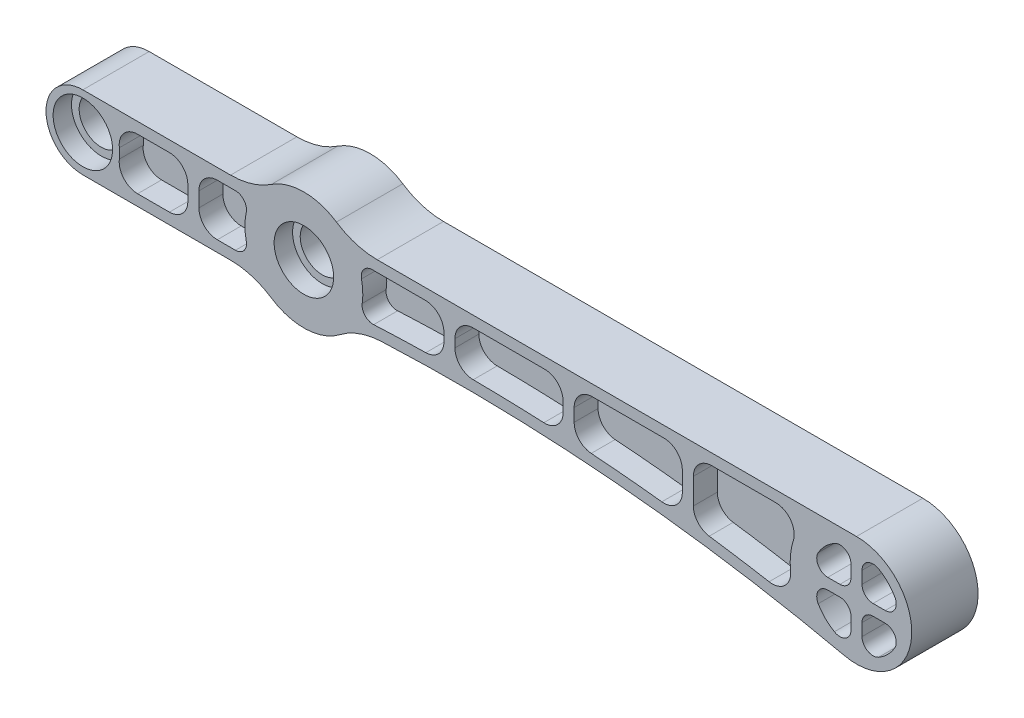
from build123d import *
from build123d.topology import SkipClean

# Parameters (mm, degrees)
SKETCH1_R               = 15
SKETCH1_R_2             = 12
EXTRUDE_THIN1_DEPTH     = 9
SKETCH2_W               = 3
SKETCH2_H               = 27
SKETCH2_W_2             = 27
SKETCH2_H_2             = 3
EXTRUDE_THIN2_DEPTH     = 18
FILLET1_R               = 3
EXTRUDE_THIN3_START     = -18
EXTRUDE_THIN3_DEPTH     = 18
EXTRUDE_THIN4_START     = -18
SKETCH4_R               = 10
SKETCH4_R_2             = 7
EXTRUDE_THIN4_DEPTH     = 18
EXTRUDE_THIN5_START     = -18
SKETCH5_R               = 10
SKETCH5_R_2             = 7
EXTRUDE_THIN5_DEPTH     = 18
BOSS_EXTRUDE1_DEPTH     = 2.5
SKETCH7_W               = 3
SKETCH7_H               = 14
SKETCH7_H_2             = 15
SKETCH7_H_3             = 12.5
SKETCH7_H_4             = 18
EXTRUDE_THIN6_DEPTH     = 6.5
FILLET2_R               = 5
FILLET3_R               = 5
BOSS_EXTRUDE4_START     = -18
SKETCH12_R              = 16
SKETCH12_R_2            = 7
BOSS_EXTRUDE4_DEPTH     = 18
CUT_EXTRUDE1_DEPTH      = 222.731820116
CUT_EXTRUDE1_DEPTH_BACK = 222.731820116
SKETCH8_R               = 11.075
BOSS_EXTRUDE2_START     = -5
SKETCH9_R               = 11.075
SKETCH9_R_2             = 6
BOSS_EXTRUDE2_DEPTH     = 8
CUT_EXTRUDE2_DEPTH      = 222.731820116
CUT_EXTRUDE2_DEPTH_BACK = 222.731820116
SKETCH10_R              = 8.075
BOSS_EXTRUDE3_START     = -5
SKETCH11_R              = 8.075
SKETCH11_R_2            = 6
BOSS_EXTRUDE3_DEPTH     = 8
FILLET4_R               = 3
FILLET5_R               = 20
BOSS_EXTRUDE5_START     = -18
SKETCH13_R              = 11.15
SKETCH13_R_2            = 8.075
BOSS_EXTRUDE5_DEPTH     = 18


# Read off the part's stored shape, not the designer's step: Extrude-Thin3
with BuildPart() as part:
    # Sketch1 → Extrude-Thin1 (new, symmetric)
    with BuildSketch(Plane.XY):
        Circle(SKETCH1_R)
        Circle(SKETCH1_R_2, mode=Mode.SUBTRACT)
    extrude(amount=EXTRUDE_THIN1_DEPTH, both=True)

    # Sketch2 → Extrude-Thin2 (add)
    with BuildSketch(Plane.XY.offset(9)):
        Rectangle(SKETCH2_W, SKETCH2_H)
        Rectangle(SKETCH2_W_2, SKETCH2_H_2)
    extrude(amount=-EXTRUDE_THIN2_DEPTH)

    # Fillet1
    fillet1_edges = [part.edges().sort_by_distance(p)[0] for p in [
        (-11.9058809, 1.5, 0),
        (-11.9058809, -1.5, 0),
        (11.9058809, -1.5, 0),
        (11.9058809, 1.5, 0),
        (1.5, -11.9058809, 0),
        (-1.5, -11.9058809, 0),
        (1.5, 11.9058809, 0),
        (-1.5, 11.9058809, 0),
        (-1.5, 1.5, 0),
        (1.5, -1.5, 0),
        (1.5, 1.5, 0),
        (-1.5, -1.5, 0),
    ]]
    fillet(fillet1_edges, radius=FILLET1_R)

    # Extrude-Thin3 outline → Extrude-Thin3 (add)
    with BuildSketch(Plane.XY.offset(9).offset(EXTRUDE_THIN3_START)):
        with BuildLine():
            Line((-210, -5), (-150, -5))
            ThreePointArc((-150, -5), (-149.566221763, -4.990587392), (-149.133260122, -4.962367288))
            ThreePointArc((-149.133260122, -4.962367288), (-75.827129103, -4.209836845), (-3.263016957, -14.640789608))
            ThreePointArc((-3.263016957, -14.640789608), (-14.909926964, 1.641364658), (0, 15))
            Line((0, 15), (-210, 15))
            ThreePointArc((-210, 15), (-220, 5), (-210, -5))
        make_face()
        with BuildLine():
            ThreePointArc((-149.393282085, -1.973657102), (-149.696355234, -1.993411175), (-150, -2))
            Line((-150, -2), (-210, -2))
            ThreePointArc((-210, -2), (-217, 5), (-210, 12))
            Line((-210, 12), (-13.416407865, 12))
            ThreePointArc((-13.416407865, 12), (-17.904937547, 1.84748787), (-15.584042572, -9.007642151))
            ThreePointArc((-15.584042572, -9.007642151), (-82.243303745, -0.823132527), (-149.393282085, -1.973657102))
        make_face(mode=Mode.SUBTRACT)
    extrude(amount=EXTRUDE_THIN3_DEPTH)

    # Sketch4 → Extrude-Thin4 (add)
    with SkipClean():  # the faces are left unmerged after this step: merging them gives an invalid solid
        with BuildSketch(Plane.XY.offset(9).offset(EXTRUDE_THIN4_START)):
            with Locations((-210, 5)):
                Circle(SKETCH4_R)
            with Locations((-210, 5)):
                Circle(SKETCH4_R_2, mode=Mode.SUBTRACT)
        extrude(amount=EXTRUDE_THIN4_DEPTH)

    # Sketch5 → Extrude-Thin5 (add)
    with SkipClean():  # the faces are left unmerged after this step: merging them gives an invalid solid
        with BuildSketch(Plane.XY.offset(9).offset(EXTRUDE_THIN5_START)):
            with Locations((-150, 5)):
                Circle(SKETCH5_R)
            with Locations((-150, 5)):
                Circle(SKETCH5_R_2, mode=Mode.SUBTRACT)
        extrude(amount=EXTRUDE_THIN5_DEPTH)

    # Sketch6 → Boss-Extrude1 (add, symmetric)
    with SkipClean():  # the faces are left unmerged after this step: merging them gives an invalid solid
        with BuildSketch(Plane.XY):
            with BuildLine():
                Line((-157.141428429, -2), (-202.858571571, -2))
                ThreePointArc((-202.858571571, -2), (-200, 5), (-202.858571571, 12))
                Line((-202.858571571, 12), (-157.141428429, 12))
                ThreePointArc((-157.141428429, 12), (-160, 5), (-157.141428429, -2))
            make_face()
            with BuildLine():
                Line((-13.416407865, 12), (-142.858571571, 12))
                ThreePointArc((-142.858571571, 12), (-140.007891732, 5.397205692), (-142.325456853, -1.411036381))
                ThreePointArc((-142.325456853, -1.411036381), (-78.703783865, -1.022236838), (-15.584042572, -9.007642151))
                ThreePointArc((-15.584042572, -9.007642151), (-17.904937547, 1.84748787), (-13.416407865, 12))
            make_face()
        extrude(amount=BOSS_EXTRUDE1_DEPTH, both=True)

    # Sketch7 → Extrude-Thin6 (add)
    with SkipClean():  # the faces are left unmerged after this step: merging them gives an invalid solid
        with BuildSketch(Plane.XY.offset(9)):
            with Locations((-180, 5)):
                Rectangle(SKETCH7_W, SKETCH7_H)
            with Locations((-78.137489718, 4.5)):
                Rectangle(SKETCH7_W, SKETCH7_H_2)
            with Locations((-110.498030645, 5.75)):
                Rectangle(SKETCH7_W, SKETCH7_H_3)
            with Locations((-45.776948792, 3)):
                Rectangle(SKETCH7_W, SKETCH7_H_4)
        extrude_thin6 = extrude(amount=-EXTRUDE_THIN6_DEPTH)

    # Fillet2
    fillet2_edges = [part.edges().sort_by_distance(p)[0] for p in [
        (-202.858571571, 12, 5.75),
        (-202.858571571, -2, 5.75),
        (-142.858571571, 12, 5.75),
        (-157.141428429, -2, 5.75),
        (-157.141428429, 12, 5.75),
        (-142.325456853, -1.411036382, 5.75),
        (-15.584042572, -9.007642151, 5.75),
        (-13.416407865, 12, 5.75),
        (-181.5, -2, 5.75),
        (-181.5, 12, 5.75),
        (-178.5, 12, 5.75),
        (-178.5, -2, 5.75),
        (-76.637489718, -1.150535418, 5.75),
        (-76.637489718, 12, 5.75),
        (-79.637489718, -0.967180713, 5.75),
        (-79.637489718, 12, 5.75),
        (-108.998030645, -0.159956438, 5.75),
        (-108.998030645, 12, 5.75),
        (-111.998030645, -0.178146837, 5.75),
        (-111.998030645, 12, 5.75),
        (-44.276948792, -4.327426121, 5.75),
        (-44.276948792, 12, 5.75),
        (-47.276948792, -3.940019265, 5.75),
        (-47.276948792, 12, 5.75),
    ]]
    fillet(fillet2_edges, radius=FILLET2_R)

    # Mirror1: Extrude-Thin6 across plane
    with SkipClean():  # the faces are left unmerged after this step: merging them gives an invalid solid
        add(extrude_thin6.mirror(Plane.XY))

    # Fillet3
    fillet3_edges = [part.edges().sort_by_distance(p)[0] for p in [
        (-13.416407865, 12, -5.75),
        (-15.584042572, -9.007642151, -5.75),
        (-142.325456853, -1.411036382, -5.75),
        (-157.141428429, 12, -5.75),
        (-157.141428429, -2, -5.75),
        (-202.858571571, -2, -5.75),
        (-202.858571571, 12, -5.75),
        (-142.858571571, 12, -5.75),
        (-181.5, 12, -5.75),
        (-181.5, -2, -5.75),
        (-178.5, -2, -5.75),
        (-178.5, 12, -5.75),
        (-79.637489718, -0.967180713, -5.75),
        (-79.637489718, 12, -5.75),
        (-76.637489718, -1.150535418, -5.75),
        (-76.637489718, 12, -5.75),
        (-111.998030645, -0.178146837, -5.75),
        (-111.998030645, 12, -5.75),
        (-108.998030645, -0.159956438, -5.75),
        (-108.998030645, 12, -5.75),
        (-47.276948792, -3.940019265, -5.75),
        (-47.276948792, 12, -5.75),
        (-44.276948792, -4.327426121, -5.75),
        (-44.276948792, 12, -5.75),
    ]]
    fillet(fillet3_edges, radius=FILLET3_R)

    # Sketch12 → Boss-Extrude4 (add)
    with BuildSketch(Plane(origin=(0, 0, -9), x_dir=(-1, 0, 0), z_dir=(0, 0, -1)).offset(BOSS_EXTRUDE4_START)):
        with Locations((150, 5)):
            Circle(SKETCH12_R)
        with Locations(Location((150, 5, 0), (0, 0, 180))):
            Circle(SKETCH12_R_2, mode=Mode.SUBTRACT)
    extrude(amount=BOSS_EXTRUDE4_DEPTH)

    # Sketch8 → Cut-Extrude1 (cut, two sides: drawn at the far end of the back side and taken through both)
    with SkipClean():  # the faces are left unmerged after this step: merging them gives an invalid solid
        with BuildSketch(Plane(origin=(0, 0, -9), x_dir=(-1, 0, 0), z_dir=(0, 0, -1)).offset(-CUT_EXTRUDE1_DEPTH_BACK)):
            with Locations((150, 5)):
                Circle(SKETCH8_R)
        extrude(amount=CUT_EXTRUDE1_DEPTH + CUT_EXTRUDE1_DEPTH_BACK, mode=Mode.SUBTRACT)

    # Sketch9 → Boss-Extrude2 (add)
    with SkipClean():  # the faces are left unmerged after this step: merging them gives an invalid solid
        with BuildSketch(Plane(origin=(0, 0, -9), x_dir=(-1, 0, 0), z_dir=(0, 0, -1)).offset(BOSS_EXTRUDE2_START)):
            with Locations((150, 5)):
                Circle(SKETCH9_R)
            with Locations((150, 5)):
                Circle(SKETCH9_R_2, mode=Mode.SUBTRACT)
        extrude(amount=-BOSS_EXTRUDE2_DEPTH)

    # Sketch10 → Cut-Extrude2 (cut, two sides: drawn at the far end of the back side and taken through both)
    with BuildSketch(Plane(origin=(0, 0, -9), x_dir=(-1, 0, 0), z_dir=(0, 0, -1)).offset(-CUT_EXTRUDE2_DEPTH_BACK)):
        with Locations((210, 5)):
            Circle(SKETCH10_R)
    extrude(amount=CUT_EXTRUDE2_DEPTH + CUT_EXTRUDE2_DEPTH_BACK, mode=Mode.SUBTRACT)

    # Sketch11 → Boss-Extrude3 (add)
    with BuildSketch(Plane(origin=(0, 0, -9), x_dir=(-1, 0, 0), z_dir=(0, 0, -1)).offset(BOSS_EXTRUDE3_START)):
        with Locations((210, 5)):
            Circle(SKETCH11_R)
        with Locations((210, 5)):
            Circle(SKETCH11_R_2, mode=Mode.SUBTRACT)
    extrude(amount=-BOSS_EXTRUDE3_DEPTH)

    # Fillet4
    fillet4_edges = [part.edges().sort_by_distance(p)[0] for p in [
        (-135.601850123, 11.978057044, 5.75),
        (-135.139645317, -0.930418087, 5.75),
        (-164.398149877, -1.978057044, 5.75),
        (-164.398149877, 11.978057044, 5.75),
        (-164.398149877, 11.978057044, -5.75),
        (-164.398149877, -1.978057044, -5.75),
        (-135.139645317, -0.930418087, -5.75),
        (-135.601850123, 11.978057044, -5.75),
    ]]
    fillet(fillet4_edges, radius=FILLET4_R)

    # Fillet5
    fillet5_edges = [part.edges().sort_by_distance(p)[0] for p in [
        (-136.805232431, -4.049757388, 0),
        (-162.489995997, -5, 0),
        (-137.510004003, 15, 0),
        (-162.489995997, 15, 0),
    ]]
    fillet(fillet5_edges, radius=FILLET5_R)

    # Sketch13 → Boss-Extrude5 (add)
    with BuildSketch(Plane.XY.offset(9).offset(BOSS_EXTRUDE5_START)):
        with Locations((-150, 5)):
            Circle(SKETCH13_R)
        with Locations((-150, 5)):
            Circle(SKETCH13_R_2, mode=Mode.SUBTRACT)
    extrude(amount=BOSS_EXTRUDE5_DEPTH)


solid = part.part
